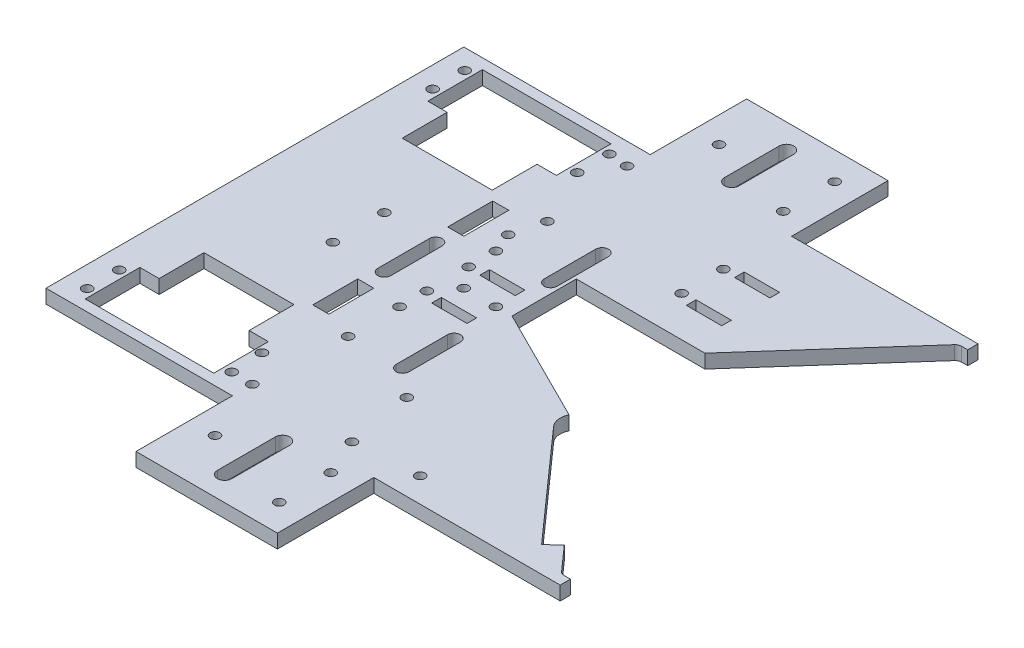
from build123d import *

# Parameters (mm, degrees)
BOSS_EXTRUDE1_DEPTH = 4.3
CUT_EXTRUDE1_DEPTH  = 4.5
FILLET1_R           = 2
CUT_EXTRUDE2_DEPTH  = 10
SKETCH8_R           = 1.5
CUT_EXTRUDE3_DEPTH  = 10
SKETCH9_R           = 1.5
CUT_EXTRUDE4_DEPTH  = 10
CUT_EXTRUDE5_DEPTH  = 10
SKETCH11_R          = 1.5
CUT_EXTRUDE6_DEPTH  = 10
SKETCH12_R          = 1.5
CUT_EXTRUDE7_DEPTH  = 10
SKETCH7_R           = 1.5
SKETCH7_W           = 11
SKETCH7_H           = 3
CUT_EXTRUDE8_DEPTH  = 9
SKETCH13_R          = 1.5
CUT_EXTRUDE9_DEPTH  = 10
SKETCH14_R          = 1.5
CUT_EXTRUDE10_DEPTH = 10
SKETCH15_W          = 5
SKETCH15_H          = 14
CUT_EXTRUDE11_DEPTH = 10
SKETCH16_R          = 1.5
CUT_EXTRUDE12_DEPTH = 10


with BuildPart() as part:
    # Sketch2 → Boss-Extrude1 (new body)
    with BuildSketch(Plane(origin=(0, 0, 0), x_dir=(1, 0, 0), z_dir=(0, 1, 0))):
        Polygon((0, 0), (0, 65), (58, 65), (58, 95), (102, 95), (102, 65), (160, 65), (160, 0), align=None)
    extrude(amount=BOSS_EXTRUDE1_DEPTH)

    # Mirror1: part across plane


with BuildPart() as part_1:
    add(part.part)
    add(part.part.mirror(Plane(origin=(0, 4.3, 0), x_dir=(1, 0, 0), z_dir=(0, 0, -1))))

    # Sketch3 → Cut-Extrude1 (cut)
    with BuildSketch(Plane(origin=(0, 4.3, 0), x_dir=(1, 0, 0), z_dir=(0, 1, 0))):
        Polygon((160, -61.8), (160, 61.8), (157.156451185, 61.8), (120.012594795, 20), (80.012594795, 20), (80.012594795, 0), (120, -20), (157.155555556, -61.8), align=None)
    extrude(amount=-CUT_EXTRUDE1_DEPTH, mode=Mode.SUBTRACT)

    # Fillet1
    fillet1_edges = [part_1.edges().sort_by_distance(p)[0] for p in [
        (157.156451185, 2.15, -61.8),
        (157.155555556, 2.15, 61.8),
    ]]
    fillet(fillet1_edges, radius=FILLET1_R)

    # Sketch6 → Cut-Extrude2 (cut)
    with BuildSketch(Plane(origin=(0, 4.3, 0), x_dir=(1, 0, 0), z_dir=(0, 1, 0))):
        Polygon((9, -61.8), (49, -61.8), (49, -44.8), (43, -44.8), (43, -30.841820122), (15, -30.841820122), (15, -44.8), (9, -44.8), align=None)
        Polygon((9, 44.8), (15, 44.8), (15, 30.841820122), (43, 30.841820122), (43, 44.8), (49, 44.8), (49, 61.8), (9, 61.8), align=None)
    extrude(amount=-CUT_EXTRUDE2_DEPTH, mode=Mode.SUBTRACT)

    # Sketch8 → Cut-Extrude3 (cut)
    with BuildSketch(Plane(origin=(0, 4.3, 0), x_dir=(1, 0, 0), z_dir=(0, 1, 0))):
        with Locations((6.5, 58.8)):
            Circle(SKETCH8_R)
        with Locations((6.5, 48.8)):
            Circle(SKETCH8_R)
        with Locations((51.5, 48.8)):
            Circle(SKETCH8_R)
        with Locations((51.5, 58.8)):
            Circle(SKETCH8_R)
        with Locations((6.5, -48.7)):
            Circle(SKETCH8_R)
        with Locations((6.5, -58.7)):
            Circle(SKETCH8_R)
        with Locations((51.5, -58.7)):
            Circle(SKETCH8_R)
        with Locations((51, -48.8)):
            Circle(SKETCH8_R)
    extrude(amount=-CUT_EXTRUDE3_DEPTH, mode=Mode.SUBTRACT)

    # Sketch9 → Cut-Extrude4 (cut)
    with BuildSketch(Plane.XZ):
        with Locations((94, 70.4)):
            Circle(SKETCH9_R)
        with Locations((66, 78.4)):
            Circle(SKETCH9_R)
        with Locations((66, -78.4)):
            Circle(SKETCH9_R)
        with Locations((94, -86.4)):
            Circle(SKETCH9_R)
        with Locations((94, 86.4)):
            Circle(SKETCH9_R)
        with Locations((94, -70.4)):
            Circle(SKETCH9_R)
        with BuildLine():
            Line((75.75, 69.4), (75.75, 87.4))
            ThreePointArc((75.75, 87.4), (78, 89.65), (80.25, 87.4))
            Line((80.25, 87.4), (80.25, 69.4))
            ThreePointArc((80.25, 69.4), (78, 67.15), (75.75, 69.4))
        make_face()
        with BuildLine():
            Line((75.75, -87.4), (75.75, -70.4))
            ThreePointArc((75.75, -70.4), (78, -68.15), (80.25, -70.4))
            Line((80.25, -70.4), (80.25, -87.4))
            ThreePointArc((80.25, -87.4), (78, -89.65), (75.75, -87.4))
        make_face()
    extrude(amount=-CUT_EXTRUDE4_DEPTH, mode=Mode.SUBTRACT)

    # Sketch10 → Cut-Extrude5 (cut)
    with BuildSketch(Plane(origin=(0, 4.3, 0), x_dir=(1, 0, 0), z_dir=(0, 1, 0))):
        with BuildLine():
            Line((123.321819194, -23.737046593), (149.896372747, -53.633419341))
            Line((149.896372747, -53.633419341), (146.159326154, -56.955238535))
            Line((146.159326154, -56.955238535), (116.262953407, -23.321819194))
            ThreePointArc((116.262953407, -23.321819194), (120.29361011, -15.008628134), (123.321819194, -23.737046593))
        make_face()
    extrude(amount=-CUT_EXTRUDE5_DEPTH, mode=Mode.SUBTRACT)

    # Sketch11 → Cut-Extrude6 (cut)
    with BuildSketch(Plane.XZ):
        with BuildLine():
            ThreePointArc((79, 31.031280577), (77, 33.031280577), (75, 31.031280577))
            Line((75, 31.031280577), (75, 15.031280577))
            ThreePointArc((75, 15.031280577), (77, 13.031280577), (79, 15.031280577))
            Line((79, 15.031280577), (79, 31.031280577))
        make_face()
        with BuildLine():
            ThreePointArc((75, -31.031280577), (77, -33.031280577), (79, -31.031280577))
            Line((79, -31.031280577), (79, -15.031280577))
            ThreePointArc((79, -15.031280577), (77, -13.031280577), (75, -15.031280577))
            Line((75, -15.031280577), (75, -31.031280577))
        make_face()
        with Locations((60, 31)):
            Circle(SKETCH11_R)
        with Locations((60, 15)):
            Circle(SKETCH11_R)
        with Locations((60, -15)):
            Circle(SKETCH11_R)
        with Locations((60, -31)):
            Circle(SKETCH11_R)
    extrude(amount=-CUT_EXTRUDE6_DEPTH, mode=Mode.SUBTRACT)

    # Sketch12 → Cut-Extrude7 (cut)
    with BuildSketch(Plane(origin=(0, 0, 0), x_dir=(-1, 0, 0), z_dir=(0, -1, 0))):
        with BuildLine():
            ThreePointArc((-50.262723036, -8), (-48.262723036, -10), (-46.262723036, -8))
            Line((-46.262723036, -8), (-46.262723036, 8))
            ThreePointArc((-46.262723036, 8), (-48.262723036, 10), (-50.262723036, 8))
            Line((-50.262723036, 8), (-50.262723036, -8))
        make_face()
        with Locations((-32.262723036, -8)):
            Circle(SKETCH12_R)
        with Locations((-32.262723036, 8)):
            Circle(SKETCH12_R)
    extrude(amount=-CUT_EXTRUDE7_DEPTH, mode=Mode.SUBTRACT)

    # Sketch7 → Cut-Extrude8 (cut)
    with BuildSketch(Plane(origin=(0, 4.3, 0), x_dir=(1, 0, 0), z_dir=(0, 1, 0))):
        with Locations((60.012594795, -6.5)):
            Circle(SKETCH7_R)
        with Locations((60.012594795, 6.5)):
            Circle(SKETCH7_R)
        with Locations((100.267282946, 32.5)):
            Circle(SKETCH7_R)
        with Locations((100.267282946, 45.5)):
            Circle(SKETCH7_R)
        with Locations((69.5, -7.5)):
            Rectangle(SKETCH7_W, SKETCH7_H)
        with Locations((69.5, 7.5)):
            Rectangle(SKETCH7_W, SKETCH7_H)
        with Locations((109.754688151, 31.5)):
            Rectangle(SKETCH7_W, SKETCH7_H)
        with Locations((109.754688151, 46.5)):
            Rectangle(SKETCH7_W, SKETCH7_H)
    extrude(amount=-CUT_EXTRUDE8_DEPTH, mode=Mode.SUBTRACT)

    # Sketch13 → Cut-Extrude9 (cut)
    with BuildSketch(Plane(origin=(0, 4.3, 0), x_dir=(1, 0, 0), z_dir=(0, 1, 0))):
        with Locations((75, 0)):
            Circle(SKETCH13_R)
        with Locations((65, 0)):
            Circle(SKETCH13_R)
    extrude(amount=-CUT_EXTRUDE9_DEPTH, mode=Mode.SUBTRACT)

    # Sketch14 → Cut-Extrude10 (cut)
    with BuildSketch(Plane(origin=(0, 4.3, 0), x_dir=(1, 0, 0), z_dir=(0, 1, 0))):
        with Locations((57.5, 58.3)):
            Circle(SKETCH14_R)
        with Locations((57.5, 21.3)):
            Circle(SKETCH14_R)
        with Locations((85.565271793, -38.309819587)):
            Circle(SKETCH14_R)
        with Locations((108.754116531, -57.343407785)):
            Circle(SKETCH14_R)
    extrude(amount=-CUT_EXTRUDE10_DEPTH, mode=Mode.SUBTRACT)

    # Sketch15 → Cut-Extrude11 (cut)
    with BuildSketch(Plane(origin=(0, 4.3, 0), x_dir=(1, 0, 0), z_dir=(0, 1, 0))):
        with Locations((48.5, 21)):
            Rectangle(SKETCH15_W, SKETCH15_H)
        with Locations((48.5, -21)):
            Rectangle(SKETCH15_W, SKETCH15_H)
    extrude(amount=-CUT_EXTRUDE11_DEPTH, mode=Mode.SUBTRACT)

    # Sketch16 → Cut-Extrude12 (cut)
    with BuildSketch(Plane(origin=(0, 4.3, 0), x_dir=(1, 0, 0), z_dir=(0, 1, 0))):
        with Locations((89, -58.8)):
            Circle(SKETCH16_R)
        with Locations((58, -58.8)):
            Circle(SKETCH16_R)
    extrude(amount=-CUT_EXTRUDE12_DEPTH, mode=Mode.SUBTRACT)


solid = part_1.part
